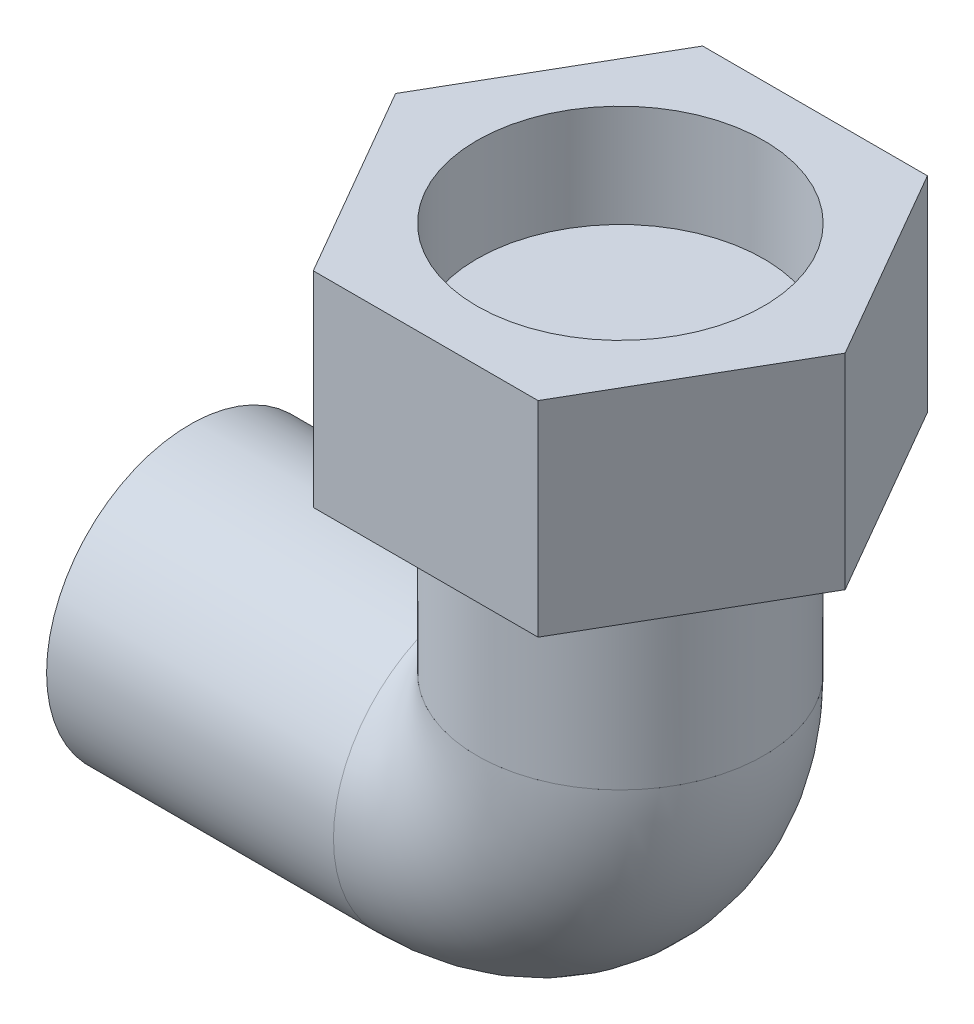
from build123d import *

# Parameters (mm, degrees)
SZKIC1_W                         = 7
SZKIC1_H                         = 14
OBR_T10_ANGLE                    = 90
DODANIE_WYCI_GNI_CIE1_DEPTH      = 5
DODANIE_WYCI_GNI_CIE1_DEPTH_BACK = 5
SZKIC7_R                         = 7


with BuildPart() as part:
    # Szkic1 → Obrót1 (revolve)
    with BuildSketch(Plane.XY):
        with Locations((24.5, 21)):
            Rectangle(SZKIC1_W, SZKIC1_H)
    revolve(axis=Axis((21, 28, 0), (0, -1, 0)))

    # Szkic7 → Dodanie-wyciągnięcie1 (add, two sides: drawn at the far end of the back side and taken through both)
    with BuildSketch(Plane(origin=(0, 28, 0), x_dir=(1, 0, 0), z_dir=(0, 1, 0)).offset(-DODANIE_WYCI_GNI_CIE1_DEPTH_BACK)):
        Polygon((15.515172443, 9.5), (10.030344885, 0), (15.515172443, -9.5), (26.484827557, -9.5), (31.969655115, 0), (26.484827557, 9.5), align=None)
        with Locations((21, 0)):
            Circle(SZKIC7_R, mode=Mode.SUBTRACT)
    extrude(amount=DODANIE_WYCI_GNI_CIE1_DEPTH + DODANIE_WYCI_GNI_CIE1_DEPTH_BACK)


with BuildPart() as body_2:
    # Szkic1<4> → Obrót2 (revolve)
    with BuildSketch(Plane.XY):
        Polygon((0, 7), (14, 7), (14, 14), (0, 14), (0, 12), align=None)
    revolve(axis=Axis((0, 7, 0), (1, 0, 0)))

    # Szkic5 → Obrót10 (revolve)
    with BuildSketch(Plane(origin=(14, 0, 0), x_dir=(0, 0, -1), z_dir=(1, 0, 0))):
        with BuildLine():
            Line((0.952614833, 13.934877431), (-0.8700852, 13.945714632))
            ThreePointArc((-0.8700852, 13.945714632), (-4.631922041, 1.751638522), (7, 7))
            ThreePointArc((7, 7), (5.275808177, 11.600635617), (0.952614833, 13.934877431))
        make_face()
    revolve(axis=Axis((14, 14, 8.415380056), (0, 0, 1)), revolution_arc=OBR_T10_ANGLE)


solid = Compound([part.part, body_2.part])
